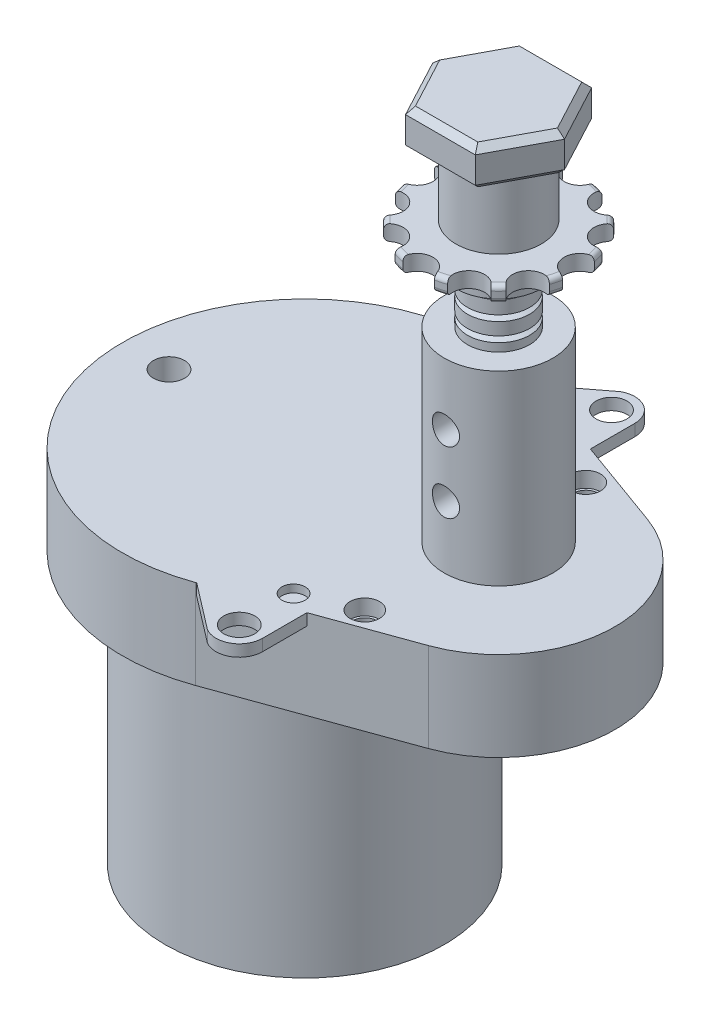
from build123d import *

# Parameters (mm, degrees)
SKETCH1_R                = 18
BOSS_EXTRUDE1_DEPTH      = 34
SKETCH2_R                = 17
BOSS_EXTRUDE2_DEPTH      = 1
BOSS_EXTRUDE3_DEPTH      = 11.5
SKETCH4_R                = 4
BOSS_EXTRUDE5_DEPTH      = 2
SKETCH5_R                = 7
BOSS_EXTRUDE6_DEPTH      = 24
SKETCH7_R                = 4
BOSS_EXTRUDE7_DEPTH      = 7
SKETCH8_R                = 5.5
BOSS_EXTRUDE8_DEPTH      = 14
SKETCH9_W                = 5
SKETCH9_H                = 2
FILLET1_R                = 0.6
FILLET2_R                = 0.6
CUT_EXTRUDE1_DEPTH       = 14
CIRPATTERN1_COUNT        = 12
BOSS_EXTRUDE10_DEPTH     = 5
CHAMFER1_SIZE            = 0.8
SKETCH14_R               = 1.9
CUT_EXTRUDE3_DEPTH       = 2
SKETCH15_R               = 1.6
CUT_EXTRUDE4_DEPTH       = 12
SKETCH16_R               = 1.5
CUT_EXTRUDE13_DEPTH      = 1
CUT_EXTRUDE7_DEPTH       = 11.5
BOSS_EXTRUDE13_DEPTH     = 4
SKETCH21_R               = 5
CUT_EXTRUDE8_DEPTH       = 0.8
SKETCH22_R               = 2.25
SKETCH22_R_2             = 2
CUT_EXTRUDE9_DEPTH       = 2
BOSS_EXTRUDE14_START     = 0.2
SKETCH23_R               = 2
BOSS_EXTRUDE14_DEPTH     = 0.2
SKETCH24_R               = 1
CUT_EXTRUDE10_DEPTH      = 4
CUT_EXTRUDE11_DEPTH      = 1
CUT_EXTRUDE11_DEPTH_BACK = 4
CUT_EXTRUDE11_START      = -4
SKETCH25_R               = 1.75
CUT_EXTRUDE12_START      = 3
SKETCH26_R               = 1.75
CUT_EXTRUDE12_DEPTH      = 4
SKETCH27_R               = 2
BOSS_EXTRUDE15_DEPTH     = 1.5


with BuildPart() as part:
    # Sketch1 → Boss-Extrude1 (new body)
    with BuildSketch(Plane(origin=(0, 0, 0), x_dir=(1, 0, 0), z_dir=(0, 1, 0))):
        Circle(SKETCH1_R)
    extrude(amount=BOSS_EXTRUDE1_DEPTH)

    # Sketch2 → Boss-Extrude2 (add)
    with BuildSketch(Plane(origin=(0, 34, 0), x_dir=(1, 0, 0), z_dir=(0, 1, 0))):
        Circle(SKETCH2_R)
    extrude(amount=BOSS_EXTRUDE2_DEPTH)

    # Sketch3 → Boss-Extrude3 (add)
    with BuildSketch(Plane(origin=(0, 35, 0), x_dir=(1, 0, 0), z_dir=(0, 1, 0))):
        with BuildLine():
            ThreePointArc((7.99, 22.099997738), (-23.5, 0), (7.99, -22.099997738))
            Line((7.99, -22.099997738), (30.1, -14.106381535))
            ThreePointArc((30.1, -14.106381535), (40, 0), (30.1, 14.106381535))
            Line((30.1, 14.106381535), (7.99, 22.099997738))
        make_face()
    extrude(amount=BOSS_EXTRUDE3_DEPTH)

    # Sketch4 → Boss-Extrude5 (add)
    with BuildSketch(Plane(origin=(0, 46.5, 0), x_dir=(1, 0, 0), z_dir=(0, 1, 0))):
        with Locations((25, 0)):
            Circle(SKETCH4_R)
    extrude(amount=BOSS_EXTRUDE5_DEPTH)

    # Sketch5 → Boss-Extrude6 (add)
    with BuildSketch(Plane(origin=(0, 48.5, 0), x_dir=(1, 0, 0), z_dir=(0, 1, 0))):
        with Locations((25, 0)):
            Circle(SKETCH5_R)
    extrude(amount=BOSS_EXTRUDE6_DEPTH)

    # Sketch7 → Boss-Extrude7 (add)
    with BuildSketch(Plane(origin=(0, 72.5, 0), x_dir=(1, 0, 0), z_dir=(0, 1, 0))):
        with Locations((25, 0)):
            Circle(SKETCH7_R)
    extrude(amount=BOSS_EXTRUDE7_DEPTH)

    # Sketch8 → Boss-Extrude8 (add)
    with BuildSketch(Plane(origin=(0, 79.5, 0), x_dir=(1, 0, 0), z_dir=(0, 1, 0))):
        with Locations((25, 0)):
            Circle(SKETCH8_R)
    extrude(amount=BOSS_EXTRUDE8_DEPTH)

    # Sketch11 → Boss-Extrude10 (add)
    with BuildSketch(Plane(origin=(0, 93.5, 0), x_dir=(1, 0, 0), z_dir=(0, 1, 0))):
        Polygon((33.5, 0), (29.5, 7.5), (20.5, 7.5), (16.5, 0), (20.5, -7.5), (29.5, -7.5), align=None)
    extrude(amount=BOSS_EXTRUDE10_DEPTH)

    # Chamfer1
    chamfer1_edges = [part.edges().sort_by_distance(p)[0] for p in [
        (25, 93.5, 7.5),
        (18.5, 93.5, 3.75),
        (18.5, 93.5, -3.75),
        (25, 93.5, -7.5),
        (31.5, 93.5, -3.75),
        (31.5, 93.5, 3.75),
        (31.5, 98.5, 3.75),
        (31.5, 98.5, -3.75),
        (25, 98.5, -7.5),
        (18.5, 98.5, -3.75),
        (18.5, 98.5, 3.75),
        (25, 98.5, 7.5),
    ]]
    chamfer(chamfer1_edges, length=CHAMFER1_SIZE)

    # Sketch13 → Cut-Revolve2 (revolve, cut)
    with BuildSketch(Plane.XY):
        Polygon((21.909378918, 78.746210508), (21, 79.112724015), (21, 78.359288891), align=None)
        Polygon((21.909378918, 76.292775384), (21, 76.659288891), (21, 75.905853767), align=None)
        Polygon((21, 74.305853767), (21, 73.552418643), (21.909378918, 73.93934026), align=None)
    revolve(axis=Axis((25, 72.5, 0), (0, 1, 0)), mode=Mode.SUBTRACT)

    # Sketch14 → Cut-Extrude3 (cut)
    with BuildSketch(Plane(origin=(0, 46.5, 0), x_dir=(1, 0, 0), z_dir=(0, 1, 0))):
        with Locations((22, 14.25)):
            Circle(SKETCH14_R)
        with Locations((22, -14.25)):
            Circle(SKETCH14_R)
    extrude(amount=-CUT_EXTRUDE3_DEPTH, mode=Mode.SUBTRACT)

    # Sketch15 → Cut-Extrude4 (cut)
    with BuildSketch(Plane(origin=(0, 44.5, 0), x_dir=(1, 0, 0), z_dir=(0, 1, 0))):
        with Locations((22, -14.25)):
            Circle(SKETCH15_R)
        with Locations((22, 14.25)):
            Circle(SKETCH15_R)
    extrude(amount=-CUT_EXTRUDE4_DEPTH, mode=Mode.SUBTRACT)

    # Sketch16 → Cut-Extrude13 (cut)
    with BuildSketch(Plane(origin=(0, 46.5, 0), x_dir=(1, 0, 0), z_dir=(0, 1, 0))):
        with Locations((15.562803405, 17)):
            Circle(SKETCH16_R)
        with Locations((15.562803405, -17)):
            Circle(SKETCH16_R)
    extrude(amount=-CUT_EXTRUDE13_DEPTH, mode=Mode.SUBTRACT)

    # Sketch19 → Cut-Extrude7 (cut)
    with BuildSketch(Plane(origin=(0, 46.5, 0), x_dir=(1, 0, 0), z_dir=(0, 1, 0))):
        with BuildLine():
            ThreePointArc((-19.5, 0), (-17.5, -2), (-15.5, 0))
            ThreePointArc((-15.5, 0), (-17.5, 2), (-19.5, 0))
        make_face()
    extrude(amount=-CUT_EXTRUDE7_DEPTH, mode=Mode.SUBTRACT)

    # Sketch20 → Boss-Extrude13 (add)
    with BuildSketch(Plane.XZ.offset(-35)):
        with BuildLine():
            ThreePointArc((18.22, -3.206493412), (26.643167673, -7.317786551), (32.5, 0))
            ThreePointArc((32.5, 0), (26.643167673, 7.317786551), (18.22, 3.206493412))
            ThreePointArc((18.22, 3.206493412), (18.429867064, 1.609347694), (18.5, 0))
            ThreePointArc((18.5, 0), (18.429867064, -1.609347694), (18.22, -3.206493412))
        make_face()
    extrude(amount=BOSS_EXTRUDE13_DEPTH)

    # Sketch21 → Cut-Extrude8 (cut)
    with BuildSketch(Plane.XZ.offset(-31)):
        with Locations((25, 0)):
            Circle(SKETCH21_R)
    extrude(amount=-CUT_EXTRUDE8_DEPTH, mode=Mode.SUBTRACT)

    # Sketch22 → Cut-Extrude9 (cut)
    with BuildSketch(Plane.XZ.offset(-31.8)):
        with Locations((25, 0)):
            Circle(SKETCH22_R)
        with Locations((25, 0)):
            Circle(SKETCH22_R_2, mode=Mode.SUBTRACT)
    extrude(amount=-CUT_EXTRUDE9_DEPTH, mode=Mode.SUBTRACT)

    # Sketch23 → Boss-Extrude14 (add)
    with BuildSketch(Plane.XZ.offset(-31.8).offset(BOSS_EXTRUDE14_START)):
        with Locations((25, 0)):
            Circle(SKETCH23_R)
    extrude(amount=-BOSS_EXTRUDE14_DEPTH)

    # Sketch24 → Cut-Extrude10 (cut)
    with BuildSketch(Plane.XZ.offset(-35)):
        with Locations((13.944044591, 17.618043854)):
            Circle(SKETCH24_R)
        with Locations((13.944044591, -17.618043854)):
            Circle(SKETCH24_R)
    extrude(amount=-CUT_EXTRUDE10_DEPTH, mode=Mode.SUBTRACT)

    # Sketch25 → Cut-Extrude11 (cut, two sides: drawn at the far end of the back side and taken through both)
    with BuildSketch(Plane.XY.offset(CUT_EXTRUDE11_START - CUT_EXTRUDE11_DEPTH_BACK)):
        with Locations((25, 64.5)):
            Circle(SKETCH25_R)
        with Locations((25, 56.5)):
            Circle(SKETCH25_R)
    extrude(amount=CUT_EXTRUDE11_DEPTH + CUT_EXTRUDE11_DEPTH_BACK, mode=Mode.SUBTRACT)

    # Sketch26 → Cut-Extrude12 (cut)
    with BuildSketch(Plane.XY.offset(CUT_EXTRUDE12_START)):
        with Locations((25, 64.5)):
            Circle(SKETCH26_R)
        with Locations((25, 56.5)):
            Circle(SKETCH26_R)
    extrude(amount=CUT_EXTRUDE12_DEPTH, mode=Mode.SUBTRACT)

    # Sketch27 → Boss-Extrude15 (add)
    # profile 1 of 2: a face of its own
    with BuildSketch(Plane(origin=(0, 46.5, 0), x_dir=(1, 0, 0), z_dir=(0, 1, 0))):
        with BuildLine():
            Line((8.125841778, 22.050885705), (18.562803405, 18.277522269))
            Line((18.562803405, 18.277522269), (18.562803405, 24))
            ThreePointArc((18.562803405, 24), (17.05672701, 26.601574958), (14.050675229, 26.591036159))
            Line((14.050675229, 26.591036159), (8.125841778, 22.050885705))
        make_face()
        with Locations((15.562803405, 24)):
            Circle(SKETCH27_R, mode=Mode.SUBTRACT)
    # profile 2 of 2: a face of its own
    with BuildSketch(Plane(origin=(0, 46.5, 0), x_dir=(1, 0, 0), z_dir=(0, 1, 0))):
        with BuildLine():
            Line((18.562803405, -24), (18.562803405, -18.277522269))
            Line((18.562803405, -18.277522269), (8.125841778, -22.050885705))
            Line((8.125841778, -22.050885705), (14.050675229, -26.591036159))
            ThreePointArc((14.050675229, -26.591036159), (17.05672701, -26.601574958), (18.562803405, -24))
        make_face()
        with Locations((15.562803405, -24)):
            Circle(SKETCH27_R, mode=Mode.SUBTRACT)
    extrude(amount=-BOSS_EXTRUDE15_DEPTH)


with BuildPart() as body_2:
    # Sketch9 → Revolve1 (revolve)
    with BuildSketch(Plane.XY):
        with Locations((17, 83.5)):
            Rectangle(SKETCH9_W, SKETCH9_H)
    revolve(axis=Axis((25.00586149, 79.5, 0), (0, 1, 0)))

    # Fillet1
    fillet1_edges = [body_2.edges().sort_by_distance(p)[0] for p in [
        (35.51172298, 84.5, 0),
    ]]
    fillet(fillet1_edges, radius=FILLET1_R)

    # Fillet2
    fillet2_edges = [body_2.edges().sort_by_distance(p)[0] for p in [
        (35.51172298, 82.5, 0),
    ]]
    fillet(fillet2_edges, radius=FILLET2_R)

    # Sketch10 → Cut-Extrude1 (cut)
    with BuildSketch(Plane(origin=(0, 84.5, 0), x_dir=(1, 0, 0), z_dir=(0, 1, 0))):
        with BuildLine():
            ThreePointArc((27.032871149, 10.811624847), (25.00593561, 11), (22.978997532, 10.811652163))
            ThreePointArc((22.978997532, 10.811652163), (25.005918461, 8.455), (27.032871149, 10.811624847))
        make_face()
    cut_extrude1 = extrude(amount=-CUT_EXTRUDE1_DEPTH, mode=Mode.SUBTRACT)

    # CirPattern1: Cut-Extrude1 ×12 about axis
    cirpattern1_axis = Axis((25, 93.5, 0), (0, 1, 0))
    for i in range(1, CIRPATTERN1_COUNT):
        add(cut_extrude1.rotate(cirpattern1_axis, i * 360 / CIRPATTERN1_COUNT), mode=Mode.SUBTRACT)


solid = Compound([part.part, body_2.part])
